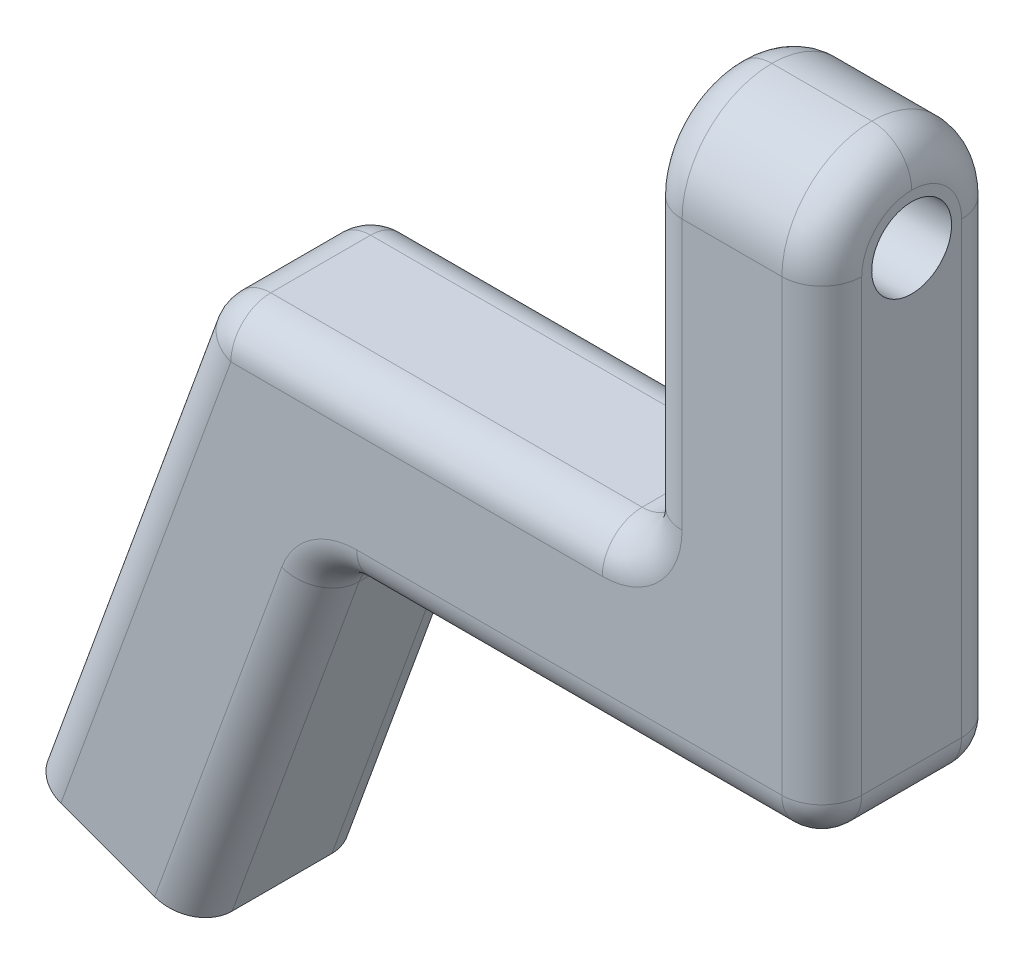
from build123d import *

# Parameters (mm, degrees)
Y_KSEKLIK_EKSTR_ZYON1_DEPTH = 9
RADYUS1_R                   = 4.5
IZIM2_R                     = 2
KES_EKSTR_ZYON1_DEPTH       = 9
IZIM3_R                     = 2.575
KES_EKSTR_ZYON2_DEPTH       = 15
RADYUS2_R                   = 2


with BuildPart() as part:
    # Çizim1 → Yükseklik-Ekstrüzyon1 (new body)
    with BuildSketch(Plane.XY):
        Polygon((0, 0), (8.99576861, 24.715671126), (30.99576861, 24.715671126), (30.99576861, 44.715671126), (39.99576861, 44.715671126), (39.99576861, 15.715671126), (15.297636454, 15.715671126), (8.457233587, -3.07818129), align=None)
    extrude(amount=Y_KSEKLIK_EKSTR_ZYON1_DEPTH)

    # Radyus1
    radyus1_edges = [part.edges().sort_by_distance(p)[0] for p in [
        (35.49576861, 44.715671126, 0),
        (35.49576861, 44.715671126, 9),
    ]]
    fillet(radyus1_edges, radius=RADYUS1_R - 0.0001)  # a hair under: the kernel refuses the full size

    # Çizim2 → Kes-Ekstrüzyon1 (cut)
    with BuildSketch(Plane(origin=(39.99576861, 0, 0), x_dir=(0, 0, -1), z_dir=(1, 0, 0))):
        with Locations(Location((-4.5, 40.215671126, 0), (0, 0, 90))):
            Circle(IZIM2_R)
    extrude(amount=-KES_EKSTR_ZYON1_DEPTH, mode=Mode.SUBTRACT)

    # Çizim3 → Kes-Ekstrüzyon2 (cut)
    with BuildSketch(Plane(origin=(0, 0, 0), x_dir=(0.9396926207859082, -0.34202014332566943, 0), z_dir=(-0.34202014332566943, -0.9396926207859082, 0))):
        with Locations((4.5, 4.5)):
            Circle(IZIM3_R)
    extrude(amount=-KES_EKSTR_ZYON2_DEPTH, mode=Mode.SUBTRACT)

    # Radyus2
    radyus2_edges = [part.edges().sort_by_distance(p)[0] for p in [
        (27.646702532, 15.715671126, 9),
        (11.87743502, 6.318744918, 0),
        (39.99576861, 27.965721126, 9),
        (8.99576861, 24.715671126, 4.5),
        (30.99576861, 24.715671126, 4.5),
        (39.99576861, 15.715671126, 4.5),
        (15.297636454, 15.715671126, 4.5),
        (19.99576861, 24.715671126, 9),
        (30.99576861, 32.465721126, 0),
        (30.99576861, 32.465721126, 9),
        (30.99576861, 43.39768093, 7.682009805),
        (30.99576861, 43.39768093, 1.317990195),
        (4.497884305, 12.357835563, 9),
        (39.99576861, 43.39768093, 7.682009805),
        (39.99576861, 43.39768093, 1.317990195),
        (11.87743502, 6.318744918, 9),
        (4.497884305, 12.357835563, 0),
        (19.99576861, 24.715671126, 0),
        (39.99576861, 27.965721126, 0),
        (27.646702532, 15.715671126, 0),
    ]]
    fillet(radyus2_edges, radius=RADYUS2_R)


solid = part.part
